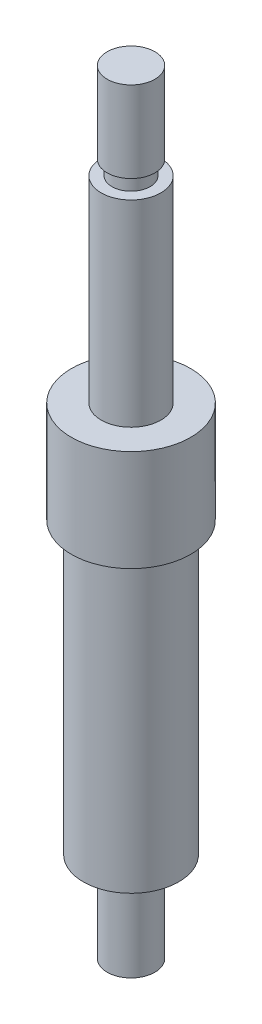
from build123d import *


with BuildPart() as part:
    # Sketch1 → Revolve1 (revolve)
    with BuildSketch(Plane.XY):
        Polygon((0, 0), (2, 0), (2, 7.56117322), (4, 7.56117322), (4, 31.838137386), (5, 31.838137386), (5, 40.333660498), (2.5, 40.333660498), (2.5, 56.833660498), (1.6, 56.833660498), (1.6, 58.033660498), (2, 58.033660498), (2, 64.833660498), (0, 64.833660498), align=None)
    revolve(axis=Axis((0, 0, 0), (0, 1, 0)))


solid = part.part
